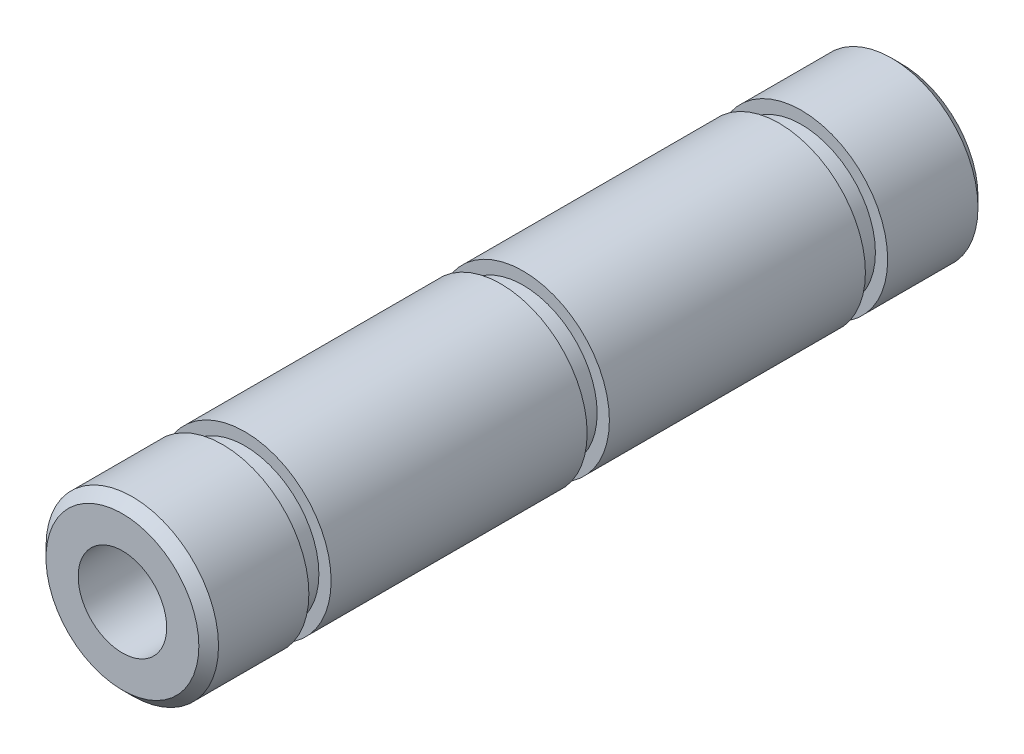
from build123d import *

# Parameters (mm, degrees)
SKETCH1_R           = 9.8425
SKETCH1_R_2         = 5.04825
BOSS_EXTRUDE1_DEPTH = 88.9
SKETCH2_W           = 2.54
SKETCH2_H           = 1.397
SKETCH5_R           = 2.7051
CUT_EXTRUDE1_DEPTH  = 88.9
THREAD1_PITCH       = 0.907142857
THREAD2_PITCH       = 0.907142857


with BuildPart() as part:
    # Sketch1 → Boss-Extrude1 (new body)
    with BuildSketch(Plane.XY):
        Circle(SKETCH1_R)
        Circle(SKETCH1_R_2, mode=Mode.SUBTRACT)
    extrude(amount=-BOSS_EXTRUDE1_DEPTH)

    # Sketch2 → Cut-Revolve1 (revolve, cut)
    with BuildSketch(Plane(origin=(0, 0, 0), x_dir=(0, 0, -1), z_dir=(1, 0, 0)), mode=Mode.PRIVATE) as cut_revolve1_sk:
        with Locations((44.45, 9.144)):
            Rectangle(SKETCH2_W, SKETCH2_H)
        with Locations((76.2, 9.144)):
            Rectangle(SKETCH2_W, SKETCH2_H)
        with Locations((12.7, 9.144)):
            Rectangle(SKETCH2_W, SKETCH2_H)
        Polygon((0, 9.8425), (0, 8.719967985), (1.122532015, 9.8425), align=None)
        Polygon((87.777467985, 9.8425), (88.9, 8.719967985), (88.9, 9.8425), align=None)
    revolve(cut_revolve1_sk.sketch.rotate(Axis((0, 0, 0), (0, 0, -1)), 90), axis=Axis((0, 0, 0), (0, 0, -1)), mode=Mode.SUBTRACT)

    # Sketch5 → Cut-Extrude1 (cut)
    with BuildSketch(Plane(origin=(0, 0, 0), x_dir=(1, 0, 0), z_dir=(0, 1, 0))):
        with Locations(Location((0, 19.05, 0), (0, 0, 270))):
            Circle(SKETCH5_R)
        with Locations(Location((0, 69.85, 0), (0, 0, 270))):
            Circle(SKETCH5_R)
    extrude(amount=-CUT_EXTRUDE1_DEPTH, mode=Mode.SUBTRACT)

    # Thread1: the profile of Thread Profile2 profile screwed along a right-hand helix of 10.85 turns, 8 arcs to a turn; built about Z, then put on its axis
    thread1_z = Axis((0, 0, 0), (0, 0, 1))
    thread1_corners = [(2.7048, 0, -0.000173205), (3.196105472, 0, 0.283482142), (3.196105472, 0, 0.396874999), (2.7048, 0, 0.680530345)]
    with BuildLine(mode=Mode.PRIVATE) as thread1_profile:
        Line(thread1_corners[0], thread1_corners[1])
        Line(thread1_corners[1], thread1_corners[2])
        Line(thread1_corners[2], thread1_corners[3])
        Line(thread1_corners[3], thread1_corners[0])
    thread1_cap = Face(thread1_profile.wire())
    thread1_turn_angles = [0, 22.5, 45, 67.5, 90, 112.5, 135, 157.5, 180, 202.5, 225, 247.5, 270, 292.5, 315, 337.5, 360]
    thread1_turn_weights = [1, 0.9238795325112867, 1, 0.9238795325112867, 1, 0.9238795325112867, 1, 0.9238795325112867, 1, 0.9238795325112867, 1, 0.9238795325112867, 1, 0.9238795325112867, 1, 0.9238795325112867, 1]
    thread1_turn_rails = [Edge.make_bspline([Vector(p[0], p[1], 0).rotate(thread1_z, thread1_turn_angles[k]) / thread1_turn_weights[k] + Vector(0, 0, p[2] + THREAD1_PITCH * thread1_turn_angles[k] / 360) for k in range(17)], [0, 0, 0, 1, 1, 2, 2, 3, 3, 4, 4, 5, 5, 6, 6, 7, 7, 8, 8, 8], 2, thread1_turn_weights) for p in thread1_corners]
    thread1_turn_sides = [Face.make_surface_from_curves(thread1_turn_rails[p[0]], thread1_turn_rails[p[1]]) for p in [(0, 1), (1, 2), (2, 3), (3, 0)]]
    thread1_last_angles = [3600, 3622.5, 3645, 3667.5, 3690, 3712.5, 3735, 3757.5, 3780, 3802.5, 3825, 3847.5, 3870, 3888, 3906]
    thread1_last_weights = [1, 0.9238795325112867, 1, 0.9238795325112867, 1, 0.9238795325112867, 1, 0.9238795325112867, 1, 0.9238795325112867, 1, 0.9238795325112867, 1, 0.9510565162951474, 1]
    thread1_last_rails = [Edge.make_bspline([Vector(p[0], p[1], 0).rotate(thread1_z, thread1_last_angles[k]) / thread1_last_weights[k] + Vector(0, 0, p[2] + THREAD1_PITCH * thread1_last_angles[k] / 360) for k in range(15)], [0, 0, 0, 1, 1, 2, 2, 3, 3, 4, 4, 5, 5, 6, 6, 7, 7, 7], 2, thread1_last_weights) for p in thread1_corners]
    thread1_last_sides = [Face.make_surface_from_curves(thread1_last_rails[p[0]], thread1_last_rails[p[1]]) for p in [(0, 1), (1, 2), (2, 3), (3, 0)]]
    thread1 = Plane(origin=(0, -9.8425, -19.05), x_dir=(1, 0, 0), z_dir=(0, 1, 0)) * Solid(Shell([*[p.moved(Location((0, 0, THREAD1_PITCH * i))) for i in range(10) for p in thread1_turn_sides], *thread1_last_sides, thread1_cap, thread1_cap.rotate(thread1_z, 3906).moved(Location((0, 0, THREAD1_PITCH * 3906 / 360)))]))
    add(thread1, mode=Mode.SUBTRACT)

    # Thread2: the profile of Thread Profile3 profile screwed along a right-hand helix of 10.85 turns, 8 arcs to a turn; built about Z, then put on its axis
    thread2_z = Axis((0, 0, 0), (0, 0, 1))
    thread2_corners = [(2.7048, 0, -0.000173205), (3.196105472, 0, 0.283482142), (3.196105472, 0, 0.396874999), (2.7048, 0, 0.680530345)]
    with BuildLine(mode=Mode.PRIVATE) as thread2_profile:
        Line(thread2_corners[0], thread2_corners[1])
        Line(thread2_corners[1], thread2_corners[2])
        Line(thread2_corners[2], thread2_corners[3])
        Line(thread2_corners[3], thread2_corners[0])
    thread2_cap = Face(thread2_profile.wire())
    thread2_turn_angles = [0, 22.5, 45, 67.5, 90, 112.5, 135, 157.5, 180, 202.5, 225, 247.5, 270, 292.5, 315, 337.5, 360]
    thread2_turn_weights = [1, 0.9238795325112867, 1, 0.9238795325112867, 1, 0.9238795325112867, 1, 0.9238795325112867, 1, 0.9238795325112867, 1, 0.9238795325112867, 1, 0.9238795325112867, 1, 0.9238795325112867, 1]
    thread2_turn_rails = [Edge.make_bspline([Vector(p[0], p[1], 0).rotate(thread2_z, thread2_turn_angles[k]) / thread2_turn_weights[k] + Vector(0, 0, p[2] + THREAD2_PITCH * thread2_turn_angles[k] / 360) for k in range(17)], [0, 0, 0, 1, 1, 2, 2, 3, 3, 4, 4, 5, 5, 6, 6, 7, 7, 8, 8, 8], 2, thread2_turn_weights) for p in thread2_corners]
    thread2_turn_sides = [Face.make_surface_from_curves(thread2_turn_rails[p[0]], thread2_turn_rails[p[1]]) for p in [(0, 1), (1, 2), (2, 3), (3, 0)]]
    thread2_last_angles = [3600, 3622.5, 3645, 3667.5, 3690, 3712.5, 3735, 3757.5, 3780, 3802.5, 3825, 3847.5, 3870, 3888, 3906]
    thread2_last_weights = [1, 0.9238795325112867, 1, 0.9238795325112867, 1, 0.9238795325112867, 1, 0.9238795325112867, 1, 0.9238795325112867, 1, 0.9238795325112867, 1, 0.9510565162951474, 1]
    thread2_last_rails = [Edge.make_bspline([Vector(p[0], p[1], 0).rotate(thread2_z, thread2_last_angles[k]) / thread2_last_weights[k] + Vector(0, 0, p[2] + THREAD2_PITCH * thread2_last_angles[k] / 360) for k in range(15)], [0, 0, 0, 1, 1, 2, 2, 3, 3, 4, 4, 5, 5, 6, 6, 7, 7, 7], 2, thread2_last_weights) for p in thread2_corners]
    thread2_last_sides = [Face.make_surface_from_curves(thread2_last_rails[p[0]], thread2_last_rails[p[1]]) for p in [(0, 1), (1, 2), (2, 3), (3, 0)]]
    thread2 = Plane(origin=(0, -9.8425, -69.85), x_dir=(1, 0, 0), z_dir=(0, 1, 0)) * Solid(Shell([*[p.moved(Location((0, 0, THREAD2_PITCH * i))) for i in range(10) for p in thread2_turn_sides], *thread2_last_sides, thread2_cap, thread2_cap.rotate(thread2_z, 3906).moved(Location((0, 0, THREAD2_PITCH * 3906 / 360)))]))
    add(thread2, mode=Mode.SUBTRACT)


solid = part.part
